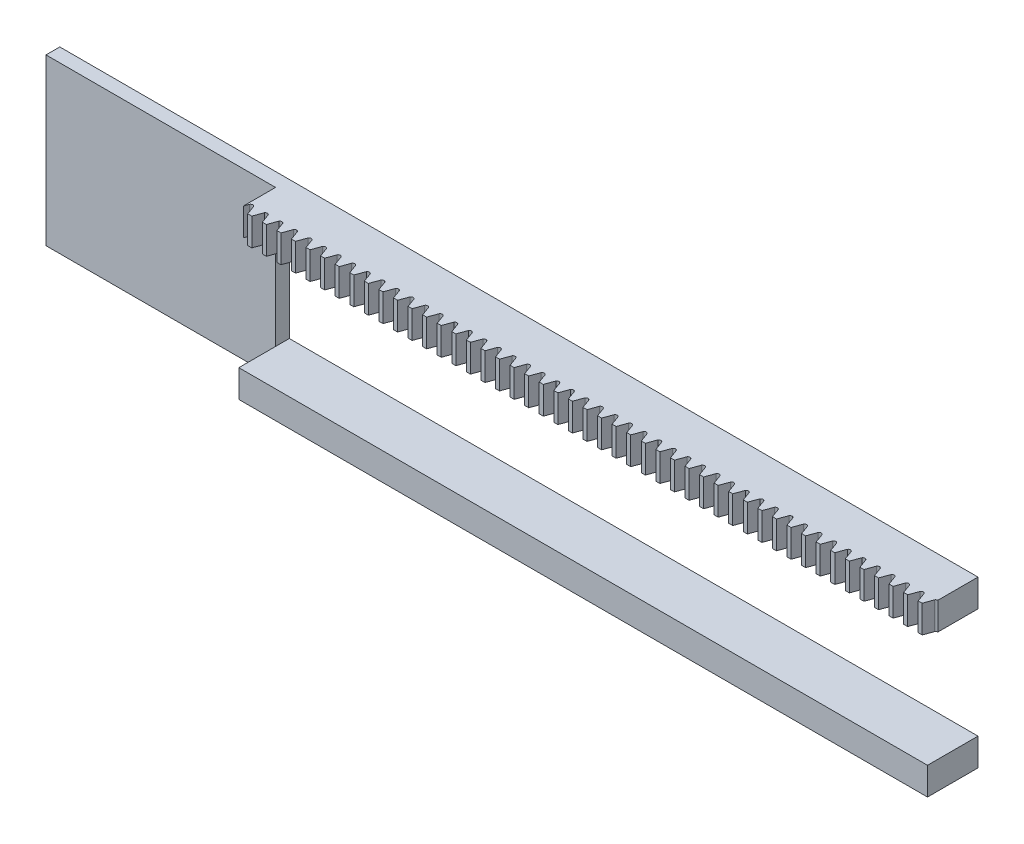
from build123d import *

# Parameters (mm, degrees)
CUT_EXTRUDE_START   = -10
CUT_EXTRUDE_1_DEPTH = 6
SKETCH_3_W          = 200
SKETCH_3_H          = 6
EXTRUDE_1_DEPTH     = 1
SKETCH_5_W          = 50
SKETCH_5_H          = 11
EXTRUDE_2_DEPTH     = 30
SKETCH_6_W          = 200
SKETCH_6_H          = 11
EXTRUDE_3_DEPTH     = 6
SKETCH_7_W          = 50
SKETCH_7_H          = 36
CUT_EXTRUDE_2_DEPTH = 8


with BuildPart() as part:
    # 切除-拉伸1: read off the stored shape, not the designer's step
    # 切除-拉伸1 outline → 切除-拉伸1 (new body)
    with BuildSketch(Plane.XZ.offset(CUT_EXTRUDE_START)):
        with BuildLine():
            Line((198.851029766, 10), (197.97436706, 10))
            Line((197.97436706, 10), (197.246426591, 8))
            ThreePointArc((197.246426591, 8), (196.825396826, 7.75), (196.40436706, 8))
            Line((196.40436706, 8), (195.676426591, 10))
            Line((195.676426591, 10), (194.799763885, 10))
            Line((194.799763885, 10), (194.071823417, 8))
            ThreePointArc((194.071823417, 8), (193.650793651, 7.75), (193.229763885, 8))
            Line((193.229763885, 8), (192.501823417, 10))
            Line((192.501823417, 10), (191.62516071, 10))
            Line((191.62516071, 10), (190.897220242, 8))
            ThreePointArc((190.897220242, 8), (190.476190476, 7.75), (190.05516071, 8))
            Line((190.05516071, 8), (189.327220242, 10))
            Line((189.327220242, 10), (188.450557536, 10))
            Line((188.450557536, 10), (187.722617067, 8))
            ThreePointArc((187.722617067, 8), (187.301587302, 7.75), (186.880557536, 8))
            Line((186.880557536, 8), (186.152617067, 10))
            Line((186.152617067, 10), (185.275954361, 10))
            Line((185.275954361, 10), (184.548013893, 8))
            ThreePointArc((184.548013893, 8), (184.126984127, 7.75), (183.705954361, 8))
            Line((183.705954361, 8), (182.978013893, 10))
            Line((182.978013893, 10), (182.101351187, 10))
            Line((182.101351187, 10), (181.373410718, 8))
            ThreePointArc((181.373410718, 8), (180.952380953, 7.75), (180.531351187, 8))
            Line((180.531351187, 8), (179.803410718, 10))
            Line((179.803410718, 10), (178.926748012, 10))
            Line((178.926748012, 10), (178.198807544, 8))
            ThreePointArc((178.198807544, 8), (177.777777778, 7.75), (177.356748012, 8))
            Line((177.356748012, 8), (176.628807544, 10))
            Line((176.628807544, 10), (175.752144837, 10))
            Line((175.752144837, 10), (175.024204369, 8))
            ThreePointArc((175.024204369, 8), (174.603174603, 7.75), (174.182144837, 8))
            Line((174.182144837, 8), (173.454204369, 10))
            Line((173.454204369, 10), (172.577541663, 10))
            Line((172.577541663, 10), (171.849601194, 8))
            ThreePointArc((171.849601194, 8), (171.428571429, 7.75), (171.007541663, 8))
            Line((171.007541663, 8), (170.279601194, 10))
            Line((170.279601194, 10), (169.402938488, 10))
            Line((169.402938488, 10), (168.67499802, 8))
            ThreePointArc((168.67499802, 8), (168.253968254, 7.75), (167.832938488, 8))
            Line((167.832938488, 8), (167.10499802, 10))
            Line((167.10499802, 10), (166.228335314, 10))
            Line((166.228335314, 10), (165.500394845, 8))
            ThreePointArc((165.500394845, 8), (165.079365079, 7.75), (164.658335314, 8))
            Line((164.658335314, 8), (163.930394845, 10))
            Line((163.930394845, 10), (163.053732139, 10))
            Line((163.053732139, 10), (162.32579167, 8))
            ThreePointArc((162.32579167, 8), (161.904761905, 7.75), (161.483732139, 8))
            Line((161.483732139, 8), (160.75579167, 10))
            Line((160.75579167, 10), (159.879128964, 10))
            Line((159.879128964, 10), (159.151188496, 8))
            ThreePointArc((159.151188496, 8), (158.73015873, 7.75), (158.309128964, 8))
            Line((158.309128964, 8), (157.581188496, 10))
            Line((157.581188496, 10), (156.70452579, 10))
            Line((156.70452579, 10), (155.976585321, 8))
            ThreePointArc((155.976585321, 8), (155.555555555, 7.75), (155.13452579, 8))
            Line((155.13452579, 8), (154.406585321, 10))
            Line((154.406585321, 10), (153.529922615, 10))
            Line((153.529922615, 10), (152.801982147, 8))
            ThreePointArc((152.801982147, 8), (152.380952381, 7.75), (151.959922615, 8))
            Line((151.959922615, 8), (151.231982147, 10))
            Line((151.231982147, 10), (150.355319441, 10))
            Line((150.355319441, 10), (149.627378972, 8))
            ThreePointArc((149.627378972, 8), (149.206349206, 7.75), (148.785319441, 8))
            Line((148.785319441, 8), (148.057378972, 10))
            Line((148.057378972, 10), (147.180716266, 10))
            Line((147.180716266, 10), (146.452775797, 8))
            ThreePointArc((146.452775797, 8), (146.031746031, 7.75), (145.610716266, 8))
            Line((145.610716266, 8), (144.882775797, 10))
            Line((144.882775797, 10), (144.006113091, 10))
            Line((144.006113091, 10), (143.278172623, 8))
            ThreePointArc((143.278172623, 8), (142.857142857, 7.75), (142.436113091, 8))
            Line((142.436113091, 8), (141.708172623, 10))
            Line((141.708172623, 10), (140.831509917, 10))
            Line((140.831509917, 10), (140.103569448, 8))
            ThreePointArc((140.103569448, 8), (139.682539682, 7.75), (139.261509917, 8))
            Line((139.261509917, 8), (138.533569448, 10))
            Line((138.533569448, 10), (137.656906742, 10))
            Line((137.656906742, 10), (136.928966274, 8))
            ThreePointArc((136.928966274, 8), (136.507936508, 7.75), (136.086906742, 8))
            Line((136.086906742, 8), (135.358966274, 10))
            Line((135.358966274, 10), (134.482303568, 10))
            Line((134.482303568, 10), (133.754363099, 8))
            ThreePointArc((133.754363099, 8), (133.333333334, 7.75), (132.912303568, 8))
            Line((132.912303568, 8), (132.184363099, 10))
            Line((132.184363099, 10), (131.307700393, 10))
            Line((131.307700393, 10), (130.579759924, 8))
            ThreePointArc((130.579759924, 8), (130.158730158, 7.75), (129.737700393, 8))
            Line((129.737700393, 8), (129.009759924, 10))
            Line((129.009759924, 10), (128.133097218, 10))
            Line((128.133097218, 10), (127.40515675, 8))
            ThreePointArc((127.40515675, 8), (126.984126984, 7.75), (126.563097218, 8))
            Line((126.563097218, 8), (125.83515675, 10))
            Line((125.83515675, 10), (124.958494044, 10))
            Line((124.958494044, 10), (124.230553575, 8))
            ThreePointArc((124.230553575, 8), (123.80952381, 7.75), (123.388494044, 8))
            Line((123.388494044, 8), (122.660553575, 10))
            Line((122.660553575, 10), (121.783890869, 10))
            Line((121.783890869, 10), (121.055950401, 8))
            ThreePointArc((121.055950401, 8), (120.634920635, 7.75), (120.213890869, 8))
            Line((120.213890869, 8), (119.485950401, 10))
            Line((119.485950401, 10), (118.609287695, 10))
            Line((118.609287695, 10), (117.881347226, 8))
            ThreePointArc((117.881347226, 8), (117.46031746, 7.75), (117.039287695, 8))
            Line((117.039287695, 8), (116.311347226, 10))
            Line((116.311347226, 10), (115.43468452, 10))
            Line((115.43468452, 10), (114.706744051, 8))
            ThreePointArc((114.706744051, 8), (114.285714286, 7.75), (113.86468452, 8))
            Line((113.86468452, 8), (113.136744051, 10))
            Line((113.136744051, 10), (112.260081345, 10))
            Line((112.260081345, 10), (111.532140877, 8))
            ThreePointArc((111.532140877, 8), (111.111111111, 7.75), (110.690081345, 8))
            Line((110.690081345, 8), (109.962140877, 10))
            Line((109.962140877, 10), (109.085478171, 10))
            Line((109.085478171, 10), (108.357537702, 8))
            ThreePointArc((108.357537702, 8), (107.936507936, 7.75), (107.515478171, 8))
            Line((107.515478171, 8), (106.787537702, 10))
            Line((106.787537702, 10), (105.910874996, 10))
            Line((105.910874996, 10), (105.182934528, 8))
            ThreePointArc((105.182934528, 8), (104.761904762, 7.75), (104.340874996, 8))
            Line((104.340874996, 8), (103.612934528, 10))
            Line((103.612934528, 10), (102.736271822, 10))
            Line((102.736271822, 10), (102.008331353, 8))
            ThreePointArc((102.008331353, 8), (101.587301588, 7.75), (101.166271822, 8))
            Line((101.166271822, 8), (100.438331353, 10))
            Line((100.438331353, 10), (99.561668647, 10))
            Line((99.561668647, 10), (98.833728178, 8))
            ThreePointArc((98.833728178, 8), (98.412698412, 7.75), (97.991668647, 8))
            Line((97.991668647, 8), (97.263728178, 10))
            Line((97.263728178, 10), (96.387065472, 10))
            Line((96.387065472, 10), (95.659125004, 8))
            ThreePointArc((95.659125004, 8), (95.238095238, 7.75), (94.817065472, 8))
            Line((94.817065472, 8), (94.089125004, 10))
            Line((94.089125004, 10), (93.212462298, 10))
            Line((93.212462298, 10), (92.484521829, 8))
            ThreePointArc((92.484521829, 8), (92.063492064, 7.75), (91.642462298, 8))
            Line((91.642462298, 8), (90.914521829, 10))
            Line((90.914521829, 10), (90.037859123, 10))
            Line((90.037859123, 10), (89.309918655, 8))
            ThreePointArc((89.309918655, 8), (88.888888889, 7.75), (88.467859123, 8))
            Line((88.467859123, 8), (87.739918655, 10))
            Line((87.739918655, 10), (86.863255949, 10))
            Line((86.863255949, 10), (86.13531548, 8))
            ThreePointArc((86.13531548, 8), (85.714285714, 7.75), (85.293255949, 8))
            Line((85.293255949, 8), (84.56531548, 10))
            Line((84.56531548, 10), (83.688652774, 10))
            Line((83.688652774, 10), (82.960712305, 8))
            ThreePointArc((82.960712305, 8), (82.53968254, 7.75), (82.118652774, 8))
            Line((82.118652774, 8), (81.390712305, 10))
            Line((81.390712305, 10), (80.514049599, 10))
            Line((80.514049599, 10), (79.786109131, 8))
            ThreePointArc((79.786109131, 8), (79.365079365, 7.75), (78.944049599, 8))
            Line((78.944049599, 8), (78.216109131, 10))
            Line((78.216109131, 10), (77.339446425, 10))
            Line((77.339446425, 10), (76.611505956, 8))
            ThreePointArc((76.611505956, 8), (76.19047619, 7.75), (75.769446425, 8))
            Line((75.769446425, 8), (75.041505956, 10))
            Line((75.041505956, 10), (74.16484325, 10))
            Line((74.16484325, 10), (73.436902782, 8))
            ThreePointArc((73.436902782, 8), (73.015873016, 7.75), (72.59484325, 8))
            Line((72.59484325, 8), (71.866902782, 10))
            Line((71.866902782, 10), (70.990240076, 10))
            Line((70.990240076, 10), (70.262299607, 8))
            ThreePointArc((70.262299607, 8), (69.841269842, 7.75), (69.420240076, 8))
            Line((69.420240076, 8), (68.692299607, 10))
            Line((68.692299607, 10), (67.815636901, 10))
            Line((67.815636901, 10), (67.087696432, 8))
            ThreePointArc((67.087696432, 8), (66.666666666, 7.75), (66.245636901, 8))
            Line((66.245636901, 8), (65.517696432, 10))
            Line((65.517696432, 10), (64.641033726, 10))
            Line((64.641033726, 10), (63.913093258, 8))
            ThreePointArc((63.913093258, 8), (63.492063492, 7.75), (63.071033726, 8))
            Line((63.071033726, 8), (62.343093258, 10))
            Line((62.343093258, 10), (61.466430552, 10))
            Line((61.466430552, 10), (60.738490083, 8))
            ThreePointArc((60.738490083, 8), (60.317460318, 7.75), (59.896430552, 8))
            Line((59.896430552, 8), (59.168490083, 10))
            Line((59.168490083, 10), (58.291827377, 10))
            Line((58.291827377, 10), (57.563886909, 8))
            ThreePointArc((57.563886909, 8), (57.142857143, 7.75), (56.721827377, 8))
            Line((56.721827377, 8), (55.993886909, 10))
            Line((55.993886909, 10), (55.117224203, 10))
            Line((55.117224203, 10), (54.389283734, 8))
            ThreePointArc((54.389283734, 8), (53.968253969, 7.75), (53.547224203, 8))
            Line((53.547224203, 8), (52.819283734, 10))
            Line((52.819283734, 10), (51.942621028, 10))
            Line((51.942621028, 10), (51.214680559, 8))
            ThreePointArc((51.214680559, 8), (50.793650793, 7.75), (50.372621028, 8))
            Line((50.372621028, 8), (49.644680559, 10))
            Line((49.644680559, 10), (48.768017853, 10))
            Line((48.768017853, 10), (48.040077385, 8))
            ThreePointArc((48.040077385, 8), (47.619047619, 7.75), (47.198017853, 8))
            Line((47.198017853, 8), (46.470077385, 10))
            Line((46.470077385, 10), (45.593414679, 10))
            Line((45.593414679, 10), (44.86547421, 8))
            ThreePointArc((44.86547421, 8), (44.444444445, 7.75), (44.023414679, 8))
            Line((44.023414679, 8), (43.29547421, 10))
            Line((43.29547421, 10), (42.418811504, 10))
            Line((42.418811504, 10), (41.690871036, 8))
            ThreePointArc((41.690871036, 8), (41.26984127, 7.75), (40.848811504, 8))
            Line((40.848811504, 8), (40.120871036, 10))
            Line((40.120871036, 10), (39.24420833, 10))
            Line((39.24420833, 10), (38.516267861, 8))
            ThreePointArc((38.516267861, 8), (38.095238096, 7.75), (37.67420833, 8))
            Line((37.67420833, 8), (36.946267861, 10))
            Line((36.946267861, 10), (36.069605155, 10))
            Line((36.069605155, 10), (35.341664686, 8))
            ThreePointArc((35.341664686, 8), (34.92063492, 7.75), (34.499605155, 8))
            Line((34.499605155, 8), (33.771664686, 10))
            Line((33.771664686, 10), (32.89500198, 10))
            Line((32.89500198, 10), (32.167061512, 8))
            ThreePointArc((32.167061512, 8), (31.746031746, 7.75), (31.32500198, 8))
            Line((31.32500198, 8), (30.597061512, 10))
            Line((30.597061512, 10), (29.720398806, 10))
            Line((29.720398806, 10), (28.992458337, 8))
            ThreePointArc((28.992458337, 8), (28.571428572, 7.75), (28.150398806, 8))
            Line((28.150398806, 8), (27.422458337, 10))
            Line((27.422458337, 10), (26.545795631, 10))
            Line((26.545795631, 10), (25.817855163, 8))
            ThreePointArc((25.817855163, 8), (25.396825397, 7.75), (24.975795631, 8))
            Line((24.975795631, 8), (24.247855163, 10))
            Line((24.247855163, 10), (23.371192456, 10))
            Line((23.371192456, 10), (22.643251988, 8))
            ThreePointArc((22.643251988, 8), (22.222222222, 7.75), (21.801192456, 8))
            Line((21.801192456, 8), (21.073251988, 10))
            Line((21.073251988, 10), (20.196589282, 10))
            Line((20.196589282, 10), (19.468648813, 8))
            ThreePointArc((19.468648813, 8), (19.047619047, 7.75), (18.626589282, 8))
            Line((18.626589282, 8), (17.898648813, 10))
            Line((17.898648813, 10), (17.021986107, 10))
            Line((17.021986107, 10), (16.294045639, 8))
            ThreePointArc((16.294045639, 8), (15.873015873, 7.75), (15.451986107, 8))
            Line((15.451986107, 8), (14.724045639, 10))
            Line((14.724045639, 10), (13.847382933, 10))
            Line((13.847382933, 10), (13.119442464, 8))
            ThreePointArc((13.119442464, 8), (12.698412699, 7.75), (12.277382933, 8))
            Line((12.277382933, 8), (11.549442464, 10))
            Line((11.549442464, 10), (10.672779758, 10))
            Line((10.672779758, 10), (9.94483929, 8))
            ThreePointArc((9.94483929, 8), (9.523809524, 7.75), (9.102779758, 8))
            Line((9.102779758, 8), (8.37483929, 10))
            Line((8.37483929, 10), (7.498176583, 10))
            Line((7.498176583, 10), (6.770236115, 8))
            ThreePointArc((6.770236115, 8), (6.349206349, 7.75), (5.928176583, 8))
            Line((5.928176583, 8), (5.200236115, 10))
            Line((5.200236115, 10), (4.323573409, 10))
            Line((4.323573409, 10), (3.59563294, 8))
            ThreePointArc((3.59563294, 8), (3.174603175, 7.75), (2.753573409, 8))
            Line((2.753573409, 8), (2.02563294, 10))
            Line((2.02563294, 10), (1.148970234, 10))
            Line((1.148970234, 10), (0.421029766, 8))
            ThreePointArc((0.421029766, 8), (0.244829565, 7.81720999), (0, 7.75))
            Line((0, 7.75), (0, 0))
            Line((0, 0), (200, 0))
            Line((200, 0), (200, 7.75))
            ThreePointArc((200, 7.75), (199.755170435, 7.81720999), (199.578970234, 8))
            Line((199.578970234, 8), (198.851029766, 10))
        make_face()
    extrude(amount=CUT_EXTRUDE_1_DEPTH)

    # 草图3 → 凸台-拉伸1 (add)
    with BuildSketch(Plane(origin=(0, 0, 0), x_dir=(-1, 0, 0), z_dir=(0, 0, -1))):
        with Locations((-100, 7)):
            Rectangle(SKETCH_3_W, SKETCH_3_H)
    extrude(amount=EXTRUDE_1_DEPTH)

    # 草图5 → 凸台-拉伸2 (add)
    with BuildSketch(Plane(origin=(0, 10, 0), x_dir=(1, 0, 0), z_dir=(0, 1, 0))):
        with Locations((25, -4.5)):
            Rectangle(SKETCH_5_W, SKETCH_5_H)
    extrude(amount=-EXTRUDE_2_DEPTH)

    # 草图6 → 凸台-拉伸3 (add)
    with BuildSketch(Plane.XZ.offset(20)):
        with Locations((100, 4.5)):
            Rectangle(SKETCH_6_W, SKETCH_6_H)
    extrude(amount=EXTRUDE_3_DEPTH)

    # 草图7 → 切除-拉伸2 (cut)
    with BuildSketch(Plane.XY.offset(10)):
        with Locations((25, -8)):
            Rectangle(SKETCH_7_W, SKETCH_7_H)
    extrude(amount=-CUT_EXTRUDE_2_DEPTH, mode=Mode.SUBTRACT)


solid = part.part
